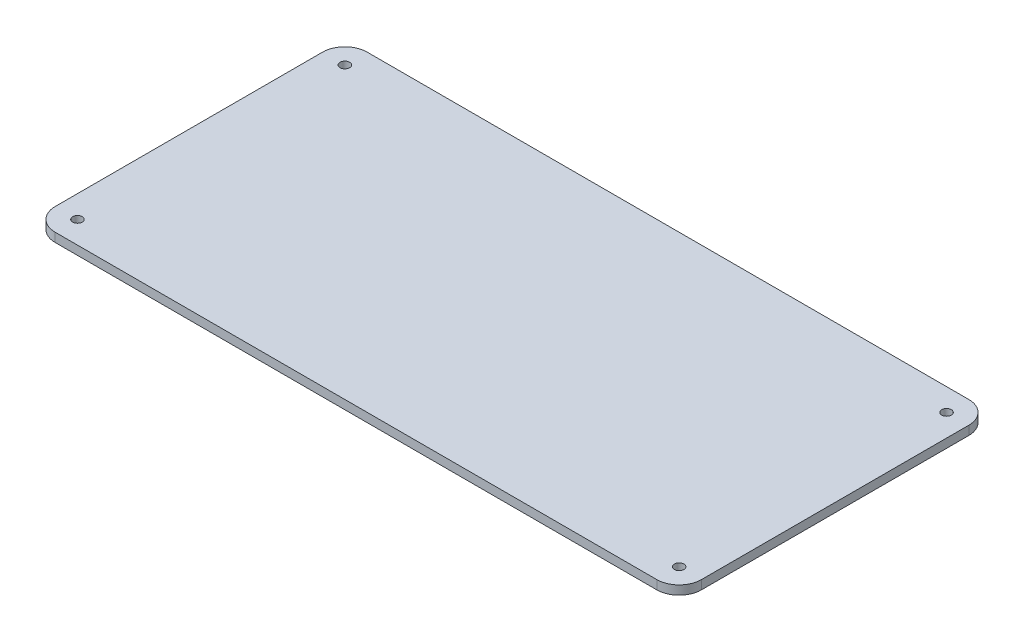
from build123d import *

# Parameters (mm, degrees)
SKETCH1_R               = 2.15
BOSS_EXTRUDE1_DEPTH     = 4
MIRROR2_COPY_1_SKETCH_R = 2.15
MIRROR2_COPY_1_DEPTH    = 4
MIRROR2_COPY_2_SKETCH_R = 2.15
MIRROR2_COPY_2_DEPTH    = 4


with BuildPart() as part:
    # Sketch1 → Boss-Extrude1 (new body)
    with BuildSketch(Plane(origin=(0, 0, 0), x_dir=(1, 0, 0), z_dir=(0, 1, 0))):
        with BuildLine():
            Line((145, -60), (145, 0))
            Line((145, 0), (0, 0))
            Line((0, 0), (0, -70))
            Line((0, -70), (135, -70))
            ThreePointArc((135, -70), (142.071067812, -67.071067812), (145, -60))
        make_face()
        with Locations((135, -60)):
            Circle(SKETCH1_R, mode=Mode.SUBTRACT)
    boss_extrude1 = extrude(amount=BOSS_EXTRUDE1_DEPTH)

    # Mirror1: Boss-Extrude1 across plane
    add(boss_extrude1.mirror(Plane(origin=(0, 0, 0), x_dir=(0, 0, 1), z_dir=(1, 0, 0))))

    # Mirror2 copy 1 sketch → Mirror2 copy 1 (add)
    with BuildSketch(Plane(origin=(0, 0, 0), x_dir=(-1, 0, 0), z_dir=(0, 1, 0))):
        with BuildLine():
            Line((145, -60), (145, 0))
            Line((145, 0), (0, 0))
            Line((0, 0), (0, -70))
            Line((0, -70), (135, -70))
            ThreePointArc((135, -70), (142.071067812, -67.071067812), (145, -60))
        make_face()
        with Locations((135, -60)):
            Circle(MIRROR2_COPY_1_SKETCH_R, mode=Mode.SUBTRACT)
    extrude(amount=MIRROR2_COPY_1_DEPTH)

    # Mirror2 copy 2 sketch → Mirror2 copy 2 (add)
    with BuildSketch(Plane(origin=(0, 0, 0), x_dir=(1, 0, 0), z_dir=(0, 1, 0))):
        with BuildLine():
            Line((145, 60), (145, 0))
            Line((145, 0), (0, 0))
            Line((0, 0), (0, 70))
            Line((0, 70), (135, 70))
            ThreePointArc((135, 70), (142.071067812, 67.071067812), (145, 60))
        make_face()
        with Locations((135, 60)):
            Circle(MIRROR2_COPY_2_SKETCH_R, mode=Mode.SUBTRACT)
    extrude(amount=MIRROR2_COPY_2_DEPTH)


solid = part.part
